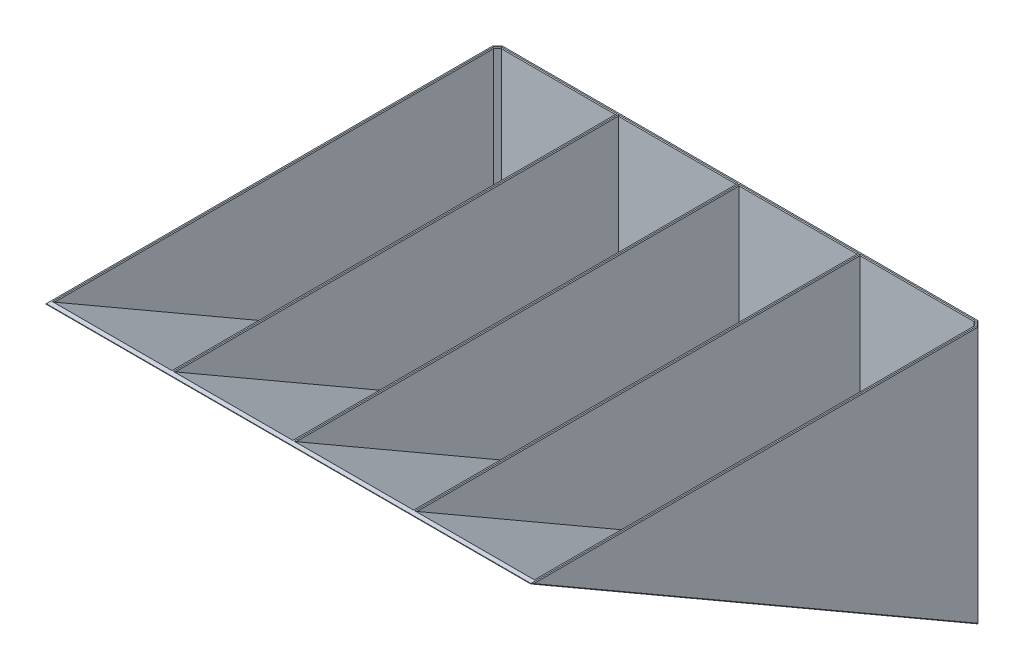
from build123d import *

# Parameters (mm, degrees)
BOSS_EXTRUDE1_DEPTH                = 130.100001
BOSS_EXTRUDE1_DEPTH_BACK           = 130.100001
BACK_CORNER_CHAMS_SIZE             = 3
COMPARTMENT_T                      = -1.5
STACKER_RIB_DEPTH                  = 120.000001
STACKER_RIB_CHAM_SIZE              = 2.4
LPATTERN1_COUNT                    = 8
LPATTERN1_PITCH                    = 35
STACKER_RIB_CHAM_OF_LPATTERN1_SIZE = 2.4
CENTER_DIVIDER_DEPTH               = 0.75
F_4_COMPARTMENT_LEFT_DIVIDER_DEPTH = 0.75
F_4_COMPARTMENT_DEBURS_SIZE        = 0.4


# Some blends are built 0.0001 mm under size
with BuildPart() as part:
    # Sketch1 → Boss-Extrude1 (new, two sides: drawn at the far end of the back side and taken through both)
    with BuildSketch(Plane(origin=(0, 0, 0), x_dir=(0, 0, -1), z_dir=(1, 0, 0)).offset(-BOSS_EXTRUDE1_DEPTH_BACK)):
        Polygon((0, 139.891970225), (0, 0), (-242.3, 139.891970225), align=None)
    extrude(amount=BOSS_EXTRUDE1_DEPTH + BOSS_EXTRUDE1_DEPTH_BACK)

    # Back Corner Chams
    back_corner_chams_edges = [part.edges().sort_by_distance(p)[0] for p in [
        (-130.100001, 69.945985112, 0),
        (130.100001, 69.945985112, 0),
    ]]
    chamfer(back_corner_chams_edges, length=BACK_CORNER_CHAMS_SIZE)

    # Compartment
    compartment_openings = [part.faces().sort_by_distance(p)[0] for p in [
        (0, 139.891970225, 121.167154086),
    ]]
    offset(amount=COMPARTMENT_T, openings=compartment_openings, kind=Kind.INTERSECTION)

    # Sketch7 → Stacker Rib (add, symmetric)
    with BuildSketch(Plane(origin=(0, 0, 0), x_dir=(0, 0, -1), z_dir=(1, 0, 0))):
        Polygon((-233.553143422, 134.841970225), (-229.042618842, 129.466536352), (-226.513466521, 128.006329579), (-224.113466521, 129.391970225), align=None)
    stacker_rib = extrude(amount=STACKER_RIB_DEPTH, both=True)

    # Stacker Rib Cham
    stacker_rib_cham_edges = [part.edges().sort_by_distance(p)[0] for p in [
        (120.000001, 128.736432965, 227.778042681),
        (-120.000001, 128.736432965, 227.778042681),
    ]]
    chamfer(stacker_rib_cham_edges, length=STACKER_RIB_CHAM_SIZE - 0.0001)  # a hair under: the kernel refuses the full size

    # LPattern1: Stacker Rib ×8
    with Locations(*[Vector(-2.642697158742682e-15, -0.5000000000000042, -0.8660254037844363) * (i * LPATTERN1_PITCH) for i in range(1, LPATTERN1_COUNT)]):
        add(stacker_rib)

    # Stacker Rib Cham of LPattern1
    stacker_rib_cham_of_lpattern1_edges = [part.edges().sort_by_distance(p)[0] for p in [
        (120.000001, 111.236432965, 197.467153549),
        (-120.000001, 111.236432965, 197.467153549),
        (120.000001, 93.736432965, 167.156264416),
        (-120.000001, 93.736432965, 167.156264416),
        (120.000001, 76.236432965, 136.845375284),
        (-120.000001, 76.236432965, 136.845375284),
        (120.000001, 58.736432965, 106.534486151),
        (-120.000001, 58.736432965, 106.534486151),
        (120.000001, 41.236432965, 76.223597019),
        (-120.000001, 41.236432965, 76.223597019),
        (120.000001, 23.736432965, 45.912707887),
        (-120.000001, 23.736432965, 45.912707887),
        (120.000001, 6.236432965, 15.601818754),
        (-120.000001, 6.236432965, 15.601818754),
    ]]
    chamfer(stacker_rib_cham_of_lpattern1_edges, length=STACKER_RIB_CHAM_OF_LPATTERN1_SIZE - 0.0001)  # a hair under: the kernel refuses the full size

    # Sketch3 → Center Divider (add, symmetric)
    with BuildSketch(Plane(origin=(0, 0, 0), x_dir=(0, 0, -1), z_dir=(1, 0, 0))):
        Polygon((0, 0), (0, 139.891970225), (-242.3, 139.891970225), align=None)
    extrude(amount=CENTER_DIVIDER_DEPTH, both=True)

    # Sketch6 → 4 Compartment Left Divider (add, symmetric)
    with BuildSketch(Plane(origin=(-64.67500064, 0, 0), x_dir=(0, 0, -1), z_dir=(1, 0, 0))):
        Polygon((0, 0), (0, 139.891970225), (-242.3, 139.891970225), align=None)
    f_4_compartment_left_divider = extrude(amount=F_4_COMPARTMENT_LEFT_DIVIDER_DEPTH, both=True)

    # 4 Compartment Right Divider: 4 Compartment Left Divider across plane
    add(f_4_compartment_left_divider.mirror(Plane(origin=(0, 0, 0), x_dir=(0, 0, 1), z_dir=(1, 0, 0))))

    # Body Deburs
    # the kernel refuses this chamfer: 0.4, 0.310325843, 0.292820323 mm, written as the material it takes off along each edge
    with BuildSketch(Plane(origin=(129.833334333, 139.709833504, 241.584529946), x_dir=(0.30151134457777734, -0.1911505329331018, -0.9341051240895171), z_dir=(0.9351131265310314, 0.25056280708570355, 0.25056280708575224))) as body_deburs_piece_1:
        Polygon((-0.478475339, -0.058726892), (0.848174577, -0.058726892), (-0.369699238, 0.117453784), align=None)
    extrude(amount=0.521697411, mode=Mode.SUBTRACT)
    with BuildSketch(Plane(origin=(-129.833334333, 139.709833504, 241.584529946), x_dir=(-0.30151134457777734, -0.1911505329331018, -0.9341051240895171), z_dir=(-0.9351131265310314, 0.25056280708570355, 0.25056280708575224))) as body_deburs_piece_2:
        Polygon((-0.478475339, 0.058726892), (0.848174577, 0.058726892), (-0.369699238, -0.117453784), align=None)
    extrude(amount=0.521697411, mode=Mode.SUBTRACT)
    with BuildSketch(Plane(origin=(127.507353852, 139.891970225, 1.5), x_dir=(0, 0.02749587661059753, -0.9996219169112964), z_dir=(-1, 0, 0))) as body_deburs_piece_3_section:
        with BuildLine():
            Line((0.411469278, 0), (-0.022618862, 0.410847117))
            Line((-0.022618862, 0.410847117), (-0.030615837, 0.41062715))
            ThreePointArc((-0.030615837, 0.41062715), (-0.013651691, 0.205359132), (-0.007996975, -0.000219967))
            Line((-0.007996975, -0.000219967), (0.000219967, -0.007996975))
            ThreePointArc((0.000219967, -0.007996975), (0.205799066, -0.00234226), (0.411689245, -0.007996975))
            Line((0.411689245, -0.007996975), (0.411469278, 0))
        make_face()
    body_deburs_piece_3 = extrude(amount=62.082353212, mode=Mode.PRIVATE)
    body_deburs_piece_3 = split(body_deburs_piece_3, bisect_by=Plane(origin=(111.116447648, 139.759963614, -13.862233009), z_dir=(-0.7071067811865476, 0, 0.7071067811865476)), keep=Keep.TOP, mode=Mode.PRIVATE)
    add(body_deburs_piece_3, mode=Mode.SUBTRACT)
    with BuildSketch(Plane(origin=(125.751298864, 139.891970225, 0.772618208), x_dir=(0.7068394360706732, 0.027495876610596933, -0.7068394360706733), z_dir=(0.7071067811865476, 0, 0.7071067811865476))) as body_deburs_piece_4_section:
        with BuildLine():
            Line((0.411469278, 0), (-0.022618862, -0.410847117))
            Line((-0.022618862, -0.410847117), (-0.030615837, -0.41062715))
            ThreePointArc((-0.030615837, -0.41062715), (-0.013651691, -0.205359132), (-0.007996975, 0.000219967))
            Line((-0.007996975, 0.000219967), (0.000219967, 0.007996975))
            ThreePointArc((0.000219967, 0.007996975), (0.205799066, 0.00234226), (0.411689245, 0.007996975))
            Line((0.411689245, 0.007996975), (0.411469278, 0))
        make_face()
    body_deburs_piece_4 = extrude(amount=5.05734639, mode=Mode.PRIVATE)
    body_deburs_piece_4 = split(body_deburs_piece_4, bisect_by=Plane(origin=(128.600001, 139.756082402, 2.472631953), z_dir=(-1, 0, 0)), keep=Keep.TOP, mode=Mode.PRIVATE)
    body_deburs_piece_4 = split(body_deburs_piece_4, bisect_by=Plane(origin=(127.627369047, 139.756082402, 1.5), z_dir=(0, 0, 1)), keep=Keep.TOP, mode=Mode.PRIVATE)
    add(body_deburs_piece_4, mode=Mode.SUBTRACT)
    with BuildSketch(Plane(origin=(128.600001, 139.891970225, 2.592647148), x_dir=(0.9996219169112964, 0.027495876610595334, 0), z_dir=(0, 0, 1))) as body_deburs_piece_5_section:
        with BuildLine():
            Line((0.411469278, 0), (-0.022618862, -0.410847117))
            Line((-0.022618862, -0.410847117), (-0.030615837, -0.41062715))
            ThreePointArc((-0.030615837, -0.41062715), (-0.013651691, -0.205359132), (-0.007996975, 0.000219967))
            Line((-0.007996975, 0.000219967), (0.000219967, 0.007996975))
            ThreePointArc((0.000219967, 0.007996975), (0.205799066, 0.00234226), (0.411689245, 0.007996975))
            Line((0.411689245, 0.007996975), (0.411469278, 0))
        make_face()
    body_deburs_piece_5 = extrude(amount=237.736026047, mode=Mode.PRIVATE)
    body_deburs_piece_5 = split(body_deburs_piece_5, bisect_by=Plane(origin=(128.731915254, 88.812183478, 150.827214114), z_dir=(0, 0.8660254037844364, -0.5000000000000039)), keep=Keep.TOP, mode=Mode.PRIVATE)
    body_deburs_piece_5 = split(body_deburs_piece_5, bisect_by=Plane(origin=(187.561507061, 139.760104476, 62.582826404), z_dir=(-0.7071067811865476, 0, 0.7071067811865476)), keep=Keep.TOP, mode=Mode.PRIVATE)
    add(body_deburs_piece_5, mode=Mode.SUBTRACT)
    with BuildSketch(Plane(origin=(-125.751298864, 139.891970225, 0.772618208), x_dir=(-0.7068394360706732, 0.027495876610596933, -0.7068394360706733), z_dir=(-0.7071067811865476, 0, 0.7071067811865476))) as body_deburs_piece_6_section:
        with BuildLine():
            Line((0.411469278, 0), (-0.022618862, 0.410847117))
            Line((-0.022618862, 0.410847117), (-0.030615837, 0.41062715))
            ThreePointArc((-0.030615837, 0.41062715), (-0.013651691, 0.205359132), (-0.007996975, -0.000219967))
            Line((-0.007996975, -0.000219967), (0.000219967, -0.007996975))
            ThreePointArc((0.000219967, -0.007996975), (0.205799066, -0.00234226), (0.411689245, -0.007996975))
            Line((0.411689245, -0.007996975), (0.411469278, 0))
        make_face()
    body_deburs_piece_6 = extrude(amount=5.05734639, mode=Mode.PRIVATE)
    body_deburs_piece_6 = split(body_deburs_piece_6, bisect_by=Plane(origin=(-128.600001, 139.756082402, 2.472631953), z_dir=(1, 0, 0)), keep=Keep.TOP, mode=Mode.PRIVATE)
    body_deburs_piece_6 = split(body_deburs_piece_6, bisect_by=Plane(origin=(-127.627369047, 139.756082402, 1.5), z_dir=(0, 0, 1)), keep=Keep.TOP, mode=Mode.PRIVATE)
    add(body_deburs_piece_6, mode=Mode.SUBTRACT)
    with BuildSketch(Plane(origin=(-128.600001, 139.891970225, 2.592647148), x_dir=(-0.9996219169112964, 0.027495876610595334, 0), z_dir=(0, 0, 1))) as body_deburs_piece_7_section:
        with BuildLine():
            Line((0.411469278, 0), (-0.022618862, 0.410847117))
            Line((-0.022618862, 0.410847117), (-0.030615837, 0.41062715))
            ThreePointArc((-0.030615837, 0.41062715), (-0.013651691, 0.205359132), (-0.007996975, -0.000219967))
            Line((-0.007996975, -0.000219967), (0.000219967, -0.007996975))
            ThreePointArc((0.000219967, -0.007996975), (0.205799066, -0.00234226), (0.411689245, -0.007996975))
            Line((0.411689245, -0.007996975), (0.411469278, 0))
        make_face()
    body_deburs_piece_7 = extrude(amount=237.736026047, mode=Mode.PRIVATE)
    body_deburs_piece_7 = split(body_deburs_piece_7, bisect_by=Plane(origin=(-128.731915254, 88.812183478, 150.827214114), z_dir=(0, 0.8660254037844364, -0.5000000000000039)), keep=Keep.TOP, mode=Mode.PRIVATE)
    body_deburs_piece_7 = split(body_deburs_piece_7, bisect_by=Plane(origin=(-187.561507061, 139.760104476, 62.582826404), z_dir=(0.7071067811865476, 0, 0.7071067811865476)), keep=Keep.TOP, mode=Mode.PRIVATE)
    add(body_deburs_piece_7, mode=Mode.SUBTRACT)
    with BuildSketch(Plane(origin=(130.100001, 1.21771421, 2.109142881), x_dir=(-0.9996219169112966, -0.02381212764408988, 0.013747938305293163), z_dir=(0, 0.5000000000000039, 0.8660254037844364))) as body_deburs_piece_8:
        with BuildLine():
            Line((0.411469278, 0), (-0.022618862, -0.410847117))
            Line((-0.022618862, -0.410847117), (-0.030615837, -0.41062715))
            ThreePointArc((-0.030615837, -0.41062715), (-0.013651691, -0.205359132), (-0.007996975, 0.000219967))
            Line((-0.007996975, 0.000219967), (0.000219967, 0.007996975))
            ThreePointArc((0.000219967, 0.007996975), (0.205799066, 0.00234226), (0.411689245, 0.007996975))
            Line((0.411689245, 0.007996975), (0.411469278, 0))
        make_face()
    extrude(amount=278.377185225, mode=Mode.SUBTRACT)
    with BuildSketch(Plane(origin=(130.100001, 139.891970225, 243.328673195), x_dir=(-0.9996219169112964, 0.027495876610595334, 0), z_dir=(0, 0, -1)), Plane(origin=(-130.100001, 139.891970225, 243.328673195), x_dir=(-0.027495876610595337, -0.9996219169112965, 0), z_dir=(0, 0, -1))) as body_deburs_piece_9:
        with BuildLine():
            Line((0.411469278, 0), (-0.022618862, -0.410847117))
            Line((-0.022618862, -0.410847117), (-0.030615837, -0.41062715))
            ThreePointArc((-0.030615837, -0.41062715), (-0.013651691, -0.205359132), (-0.007996975, 0.000219967))
            Line((-0.007996975, 0.000219967), (0.000219967, 0.007996975))
            ThreePointArc((0.000219967, 0.007996975), (0.205799066, 0.00234226), (0.411689245, 0.007996975))
            Line((0.411689245, 0.007996975), (0.411469278, 0))
        make_face()
    extrude(amount=241.35734639, mode=Mode.SUBTRACT)
    with BuildSketch(Plane(origin=(126.372619208, 139.891970225, -0.727381792), x_dir=(-0.7068394360706732, 0.027495876610595566, 0.7068394360706733), z_dir=(0.7071067811865476, 0, 0.7071067811865476)), Plane(origin=(-126.372619208, 139.891970225, -0.727381792), x_dir=(-0.01944252080601816, -0.9996219169112965, -0.019442520806018278), z_dir=(-0.7071067811865476, 0, 0.7071067811865476))) as body_deburs_piece_10:
        with BuildLine():
            Line((0.411469278, 0), (-0.022618862, 0.410847117))
            Line((-0.022618862, 0.410847117), (-0.030615837, 0.41062715))
            ThreePointArc((-0.030615837, 0.41062715), (-0.013651691, 0.205359132), (-0.007996975, -0.000219967))
            Line((-0.007996975, -0.000219967), (0.000219967, -0.007996975))
            ThreePointArc((0.000219967, -0.007996975), (0.205799066, -0.00234226), (0.411689245, -0.007996975))
            Line((0.411689245, -0.007996975), (0.411469278, 0))
        make_face()
    extrude(amount=6.299987077, mode=Mode.SUBTRACT)
    with BuildSketch(Plane(origin=(-128.128674195, 139.891970225, 0), x_dir=(0, -0.9996219169112966, -0.027495876610585723), z_dir=(1, 0, 0))) as body_deburs_piece_11:
        with BuildLine():
            Line((0.411469278, 0), (-0.022618862, -0.410847117))
            Line((-0.022618862, -0.410847117), (-0.030615837, -0.41062715))
            ThreePointArc((-0.030615837, -0.41062715), (-0.013651691, -0.205359132), (-0.007996975, 0.000219967))
            Line((-0.007996975, 0.000219967), (0.000219967, 0.007996975))
            ThreePointArc((0.000219967, 0.007996975), (0.205799066, 0.00234226), (0.411689245, 0.007996975))
            Line((0.411689245, 0.007996975), (0.411469278, 0))
        make_face()
    extrude(amount=256.25734839, mode=Mode.SUBTRACT)
    with BuildSketch(Plane(origin=(-130.100001, 1.21771421, 2.109142881), x_dir=(0.9996219169112966, -0.02381212764408988, 0.013747938305293163), z_dir=(0, 0.5000000000000039, 0.8660254037844364))) as body_deburs_piece_12:
        with BuildLine():
            Line((0.411469278, 0), (-0.022618862, 0.410847117))
            Line((-0.022618862, 0.410847117), (-0.030615837, 0.41062715))
            ThreePointArc((-0.030615837, 0.41062715), (-0.013651691, 0.205359132), (-0.007996975, -0.000219967))
            Line((-0.007996975, -0.000219967), (0.000219967, -0.007996975))
            ThreePointArc((0.000219967, -0.007996975), (0.205799066, -0.00234226), (0.411689245, -0.007996975))
            Line((0.411689245, -0.007996975), (0.411469278, 0))
        make_face()
    extrude(amount=278.377185225, mode=Mode.SUBTRACT)
    with BuildSketch(Plane(origin=(131.128674195, 139.891970225, 242.3), x_dir=(0, -0.5455824869680519, -0.8380571280728751), z_dir=(-1, 0, 0))) as body_deburs_piece_13:
        with BuildLine():
            Line((0.289092619, 0), (0.338531824, -0.23388709))
            Line((0.338531824, -0.23388709), (0.334167164, -0.240591547))
            ThreePointArc((0.334167164, -0.240591547), (0.167987533, -0.118907235), (-0.00436466, -0.006704457))
            Line((-0.00436466, -0.006704457), (0.000427678, 0.00798856))
            ThreePointArc((0.000427678, 0.00798856), (0.144560882, 0.000272204), (0.289520297, 0.00798856))
            Line((0.289520297, 0.00798856), (0.289092619, 0))
        make_face()
    extrude(amount=262.25734839, mode=Mode.SUBTRACT)
    with BuildSketch(Plane(origin=(126.426576317, -0.388801922, -0.673424683), x_dir=(-0.7551298715314874, 0.28717157801696425, 0.5893312836597817), z_dir=(0.6546536707079762, 0.3779644730092306, 0.6546536707079762))) as body_deburs_piece_14:
        with BuildLine():
            Line((0.3172442, 0), (0.116825908, -0.394536024))
            Line((0.116825908, -0.394536024), (0.109220487, -0.39701747))
            ThreePointArc((0.109220487, -0.39701747), (0.056185378, -0.197994811), (-0.007605421, -0.002481446))
            Line((-0.007605421, -0.002481446), (0.000367742, 0.007991543))
            ThreePointArc((0.000367742, 0.007991543), (0.158654668, 0.000707748), (0.317611942, 0.007991543))
            Line((0.317611942, 0.007991543), (0.3172442, 0))
        make_face()
    extrude(amount=6.639922085, mode=Mode.SUBTRACT)
    with BuildSketch(Plane(origin=(-126.426576317, -0.388801922, -0.673424683), x_dir=(0.7551298715314874, 0.2871715780169642, 0.5893312836597817), z_dir=(-0.6546536707079762, 0.3779644730092306, 0.6546536707079762))) as body_deburs_piece_15:
        with BuildLine():
            Line((0.3172442, 0), (0.116825908, 0.394536024))
            Line((0.116825908, 0.394536024), (0.109220487, 0.39701747))
            ThreePointArc((0.109220487, 0.39701747), (0.056185378, 0.197994811), (-0.007605421, 0.002481446))
            Line((-0.007605421, 0.002481446), (0.000367742, -0.007991543))
            ThreePointArc((0.000367742, -0.007991543), (0.158654668, -0.000707748), (0.317611942, -0.007991543))
            Line((0.317611942, -0.007991543), (0.3172442, 0))
        make_face()
    extrude(amount=6.639922085, mode=Mode.SUBTRACT)
    with BuildSketch(Plane(origin=(-128.128674195, 0, 0), x_dir=(0, 0.47599883081156275, 0.879445912530171), z_dir=(1, 0, 0))) as body_deburs_piece_16:
        with BuildLine():
            Line((0.411469278, 0), (0.12776162, -0.268517987))
            Line((0.12776162, -0.268517987), (0.120726053, -0.272325977))
            ThreePointArc((0.120726053, -0.272325977), (0.063641079, -0.134388748), (-0.007035567, -0.003807991))
            Line((-0.007035567, -0.003807991), (0.000219967, 0.007996975))
            ThreePointArc((0.000219967, 0.007996975), (0.205799066, 0.00234226), (0.411689245, 0.007996975))
            Line((0.411689245, 0.007996975), (0.411469278, 0))
        make_face()
    extrude(amount=256.25734839, mode=Mode.SUBTRACT)
    with BuildSketch(Plane(origin=(127.507353852, 139.891970225, 1.5), x_dir=(0, 0.02749587661059753, -0.9996219169112964), z_dir=(-1, 0, 0))) as body_deburs_piece_17a_section:
        with BuildLine():
            Line((0.411469278, 0), (-0.022618862, 0.410847117))
            Line((-0.022618862, 0.410847117), (-0.030615837, 0.41062715))
            ThreePointArc((-0.030615837, 0.41062715), (-0.013651691, 0.205359132), (-0.007996975, -0.000219967))
            Line((-0.007996975, -0.000219967), (0.000219967, -0.007996975))
            ThreePointArc((0.000219967, -0.007996975), (0.205799066, -0.00234226), (0.411689245, -0.007996975))
            Line((0.411689245, -0.007996975), (0.411469278, 0))
        make_face()
    body_deburs_piece_17a = extrude(amount=62.082353212, mode=Mode.PRIVATE)
    body_deburs_piece_17a = split(body_deburs_piece_17a, bisect_by=Plane(origin=(126.630344982, 139.764732975, 1.651664325), z_dir=(0.7071067811865476, 0, -0.7071067811865476)), keep=Keep.TOP, mode=Mode.PRIVATE)
    with BuildSketch(Plane(origin=(125.751298864, 139.891970225, 0.772618208), x_dir=(0.7068394360706732, 0.027495876610596933, -0.7068394360706733), z_dir=(0.7071067811865476, 0, 0.7071067811865476))) as body_deburs_piece_17b_section:
        with BuildLine():
            Line((0.411469278, 0), (-0.022618862, -0.410847117))
            Line((-0.022618862, -0.410847117), (-0.030615837, -0.41062715))
            ThreePointArc((-0.030615837, -0.41062715), (-0.013651691, -0.205359132), (-0.007996975, 0.000219967))
            Line((-0.007996975, 0.000219967), (0.000219967, 0.007996975))
            ThreePointArc((0.000219967, 0.007996975), (0.205799066, 0.00234226), (0.411689245, 0.007996975))
            Line((0.411689245, 0.007996975), (0.411469278, 0))
        make_face()
    body_deburs_piece_17b = extrude(amount=5.05734639, mode=Mode.PRIVATE)
    body_deburs_piece_17b = split(body_deburs_piece_17b, bisect_by=Plane(origin=(126.264194911, 139.764732975, 1.5), z_dir=(0, 0, -1)), keep=Keep.TOP, mode=Mode.PRIVATE)
    body_deburs_piece_17 = body_deburs_piece_17a & body_deburs_piece_17b
    add(body_deburs_piece_17, mode=Mode.SUBTRACT)
    with BuildSketch(Plane(origin=(125.751298864, 139.891970225, 0.772618208), x_dir=(0.7068394360706732, 0.027495876610596933, -0.7068394360706733), z_dir=(0.7071067811865476, 0, 0.7071067811865476))) as body_deburs_piece_18a_section:
        with BuildLine():
            Line((0.411469278, 0), (-0.022618862, -0.410847117))
            Line((-0.022618862, -0.410847117), (-0.030615837, -0.41062715))
            ThreePointArc((-0.030615837, -0.41062715), (-0.013651691, -0.205359132), (-0.007996975, 0.000219967))
            Line((-0.007996975, 0.000219967), (0.000219967, 0.007996975))
            ThreePointArc((0.000219967, 0.007996975), (0.205799066, 0.00234226), (0.411689245, 0.007996975))
            Line((0.411689245, 0.007996975), (0.411469278, 0))
        make_face()
    body_deburs_piece_18a = extrude(amount=5.05734639, mode=Mode.PRIVATE)
    body_deburs_piece_18a = split(body_deburs_piece_18a, bisect_by=Plane(origin=(128.600001, 139.764732975, 3.835806089), z_dir=(1, 0, 0)), keep=Keep.TOP, mode=Mode.PRIVATE)
    with BuildSketch(Plane(origin=(128.600001, 139.891970225, 2.592647148), x_dir=(0.9996219169112964, 0.027495876610595334, 0), z_dir=(0, 0, 1))) as body_deburs_piece_18b_section:
        with BuildLine():
            Line((0.411469278, 0), (-0.022618862, -0.410847117))
            Line((-0.022618862, -0.410847117), (-0.030615837, -0.41062715))
            ThreePointArc((-0.030615837, -0.41062715), (-0.013651691, -0.205359132), (-0.007996975, 0.000219967))
            Line((-0.007996975, 0.000219967), (0.000219967, 0.007996975))
            ThreePointArc((0.000219967, 0.007996975), (0.205799066, 0.00234226), (0.411689245, 0.007996975))
            Line((0.411689245, 0.007996975), (0.411469278, 0))
        make_face()
    body_deburs_piece_18b = extrude(amount=237.736026047, mode=Mode.PRIVATE)
    body_deburs_piece_18b = split(body_deburs_piece_18b, bisect_by=Plane(origin=(128.448336675, 139.764732975, 3.469656018), z_dir=(0.7071067811865476, 0, -0.7071067811865476)), keep=Keep.TOP, mode=Mode.PRIVATE)
    body_deburs_piece_18 = body_deburs_piece_18a & body_deburs_piece_18b
    add(body_deburs_piece_18, mode=Mode.SUBTRACT)
    with BuildSketch(Plane(origin=(-125.751298864, 139.891970225, 0.772618208), x_dir=(-0.7068394360706732, 0.027495876610596933, -0.7068394360706733), z_dir=(-0.7071067811865476, 0, 0.7071067811865476))) as body_deburs_piece_19a_section:
        with BuildLine():
            Line((0.411469278, 0), (-0.022618862, 0.410847117))
            Line((-0.022618862, 0.410847117), (-0.030615837, 0.41062715))
            ThreePointArc((-0.030615837, 0.41062715), (-0.013651691, 0.205359132), (-0.007996975, -0.000219967))
            Line((-0.007996975, -0.000219967), (0.000219967, -0.007996975))
            ThreePointArc((0.000219967, -0.007996975), (0.205799066, -0.00234226), (0.411689245, -0.007996975))
            Line((0.411689245, -0.007996975), (0.411469278, 0))
        make_face()
    body_deburs_piece_19a = extrude(amount=5.05734639, mode=Mode.PRIVATE)
    body_deburs_piece_19a = split(body_deburs_piece_19a, bisect_by=Plane(origin=(-128.600001, 139.764732975, 3.835806089), z_dir=(-1, 0, 0)), keep=Keep.TOP, mode=Mode.PRIVATE)
    with BuildSketch(Plane(origin=(-128.600001, 139.891970225, 2.592647148), x_dir=(-0.9996219169112964, 0.027495876610595334, 0), z_dir=(0, 0, 1))) as body_deburs_piece_19b_section:
        with BuildLine():
            Line((0.411469278, 0), (-0.022618862, 0.410847117))
            Line((-0.022618862, 0.410847117), (-0.030615837, 0.41062715))
            ThreePointArc((-0.030615837, 0.41062715), (-0.013651691, 0.205359132), (-0.007996975, -0.000219967))
            Line((-0.007996975, -0.000219967), (0.000219967, -0.007996975))
            ThreePointArc((0.000219967, -0.007996975), (0.205799066, -0.00234226), (0.411689245, -0.007996975))
            Line((0.411689245, -0.007996975), (0.411469278, 0))
        make_face()
    body_deburs_piece_19b = extrude(amount=237.736026047, mode=Mode.PRIVATE)
    body_deburs_piece_19b = split(body_deburs_piece_19b, bisect_by=Plane(origin=(-128.448336675, 139.764732975, 3.469656018), z_dir=(-0.7071067811865476, 0, -0.7071067811865476)), keep=Keep.TOP, mode=Mode.PRIVATE)
    body_deburs_piece_19 = body_deburs_piece_19a & body_deburs_piece_19b
    add(body_deburs_piece_19, mode=Mode.SUBTRACT)

    # 4 Compartment Deburs
    f_4_compartment_deburs_edges = [part.edges().sort_by_distance(p)[0] for p in [
        (65.42500064, 139.891970225, 120.2),
        (63.92500064, 139.891970225, 120.4),
        (32.33750032, 139.891970225, 1.5),
        (0.75, 139.891970225, 120.4),
        (-0.75, 139.891970225, 120.4),
        (-63.92500064, 139.891970225, 120.4),
        (-32.33750032, 139.891970225, 1.5),
        (-65.42500064, 139.891970225, 120.4),
        (-96.234683361, 139.891970225, 1.5),
    ]]
    chamfer(f_4_compartment_deburs_edges, length=F_4_COMPARTMENT_DEBURS_SIZE)


solid = part.part
